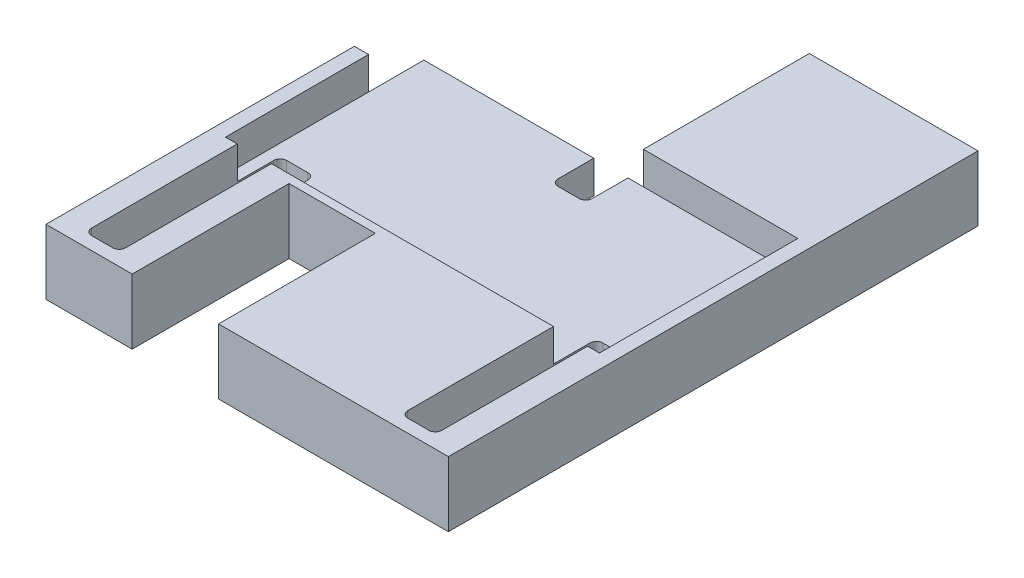
from build123d import *

# Parameters (mm, degrees)
BOSS_EXTRUDE5_DEPTH = 10
CUT_EXTRUDE6_DEPTH  = 5
FILLET4_R           = 1
MIRROR25_DEPTH      = 10
MIRROR25_2_DEPTH    = 5
SKETCH20_W          = 13.27
SKETCH20_H          = 33.288518674
CUT_EXTRUDE7_DEPTH  = 10


# Read off the part's stored shape, not the designer's step: Mirror25
with BuildPart() as part:
    # Sketch15 → Boss-Extrude5 (new body)
    with BuildSketch(Plane(origin=(0, 0, 0), x_dir=(1, 0, 0), z_dir=(0, 1, 0))):
        Polygon((24.3, 76.900659127), (-6.625, 76.900659127), (-6.625, -4.5), (24.3, -4.5), (24.3, 44.900659127), (21.675, 44.900659127), (21.675, 47.400659127), (21.675, 72.400659127), (21.675, 74.900659127), (24.3, 74.900659127), align=None)
        Polygon((-2.625, 25), (-2.625, 0), (-2.625, -2.5), (0, -2.5), (2.625, -2.5), (2.625, 0), (2.625, 25), (2.625, 27.5), (0, 27.5), (-2.625, 27.5), align=None, mode=Mode.SUBTRACT)
    extrude(amount=BOSS_EXTRUDE5_DEPTH)

    # Sketch18 → Cut-Extrude6 (cut)
    with BuildSketch(Plane(origin=(0, 10, 0), x_dir=(1, 0, 0), z_dir=(0, 1, 0))):
        Polygon((21.675, 51.3980649), (-4.44053483, 51.3980649), (-4.44053483, 20.8980649), (24.3, 20.8980649), (24.3, 51.3980649), align=None)
    extrude(amount=-CUT_EXTRUDE6_DEPTH, mode=Mode.SUBTRACT)

    # Fillet4
    fillet4_edges = [part.edges().sort_by_distance(p)[0] for p in [
        (21.675, 5, -74.900659127),
        (-2.625, 5, 2.5),
        (2.625, 5, 2.5),
        (2.625, 2.5, -27.5),
        (-2.625, 2.5, -27.5),
        (21.675, 2.5, -44.900659127),
    ]]
    fillet(fillet4_edges, radius=FILLET4_R)

    # Mirror25 outline → Mirror25 (add)
    with BuildSketch(Plane(origin=(0, 0, 0), x_dir=(1, 0, 0), z_dir=(0, 1, 0))):
        with BuildLine():
            Line((45.975, 20.8980649), (24.3, 20.8980649))
            Line((24.3, 20.8980649), (24.3, -4.5))
            Line((24.3, -4.5), (55.225, -4.5))
            Line((55.225, -4.5), (55.225, 76.900659127))
            Line((55.225, 76.900659127), (24.3, 76.900659127))
            Line((24.3, 76.900659127), (24.3, 74.900659127))
            Line((24.3, 74.900659127), (25.925, 74.900659127))
            ThreePointArc((25.925, 74.900659127), (26.632106781, 74.607765908), (26.925, 73.900659127))
            Line((26.925, 73.900659127), (26.925, 51.3980649))
            Line((26.925, 51.3980649), (53.04053483, 51.3980649))
            Line((53.04053483, 51.3980649), (53.04053483, 20.8980649))
            Line((53.04053483, 20.8980649), (51.225, 20.8980649))
            Line((51.225, 20.8980649), (51.225, -1.5))
            ThreePointArc((51.225, -1.5), (50.932106781, -2.207106781), (50.225, -2.5))
            Line((50.225, -2.5), (46.975, -2.5))
            ThreePointArc((46.975, -2.5), (46.267893219, -2.207106781), (45.975, -1.5))
            Line((45.975, -1.5), (45.975, 20.8980649))
        make_face()
    extrude(amount=MIRROR25_DEPTH)

    # Mirror25 2 outline → Mirror25 2 (add)
    with BuildSketch(Plane(origin=(0, 0, 0), x_dir=(1, 0, 0), z_dir=(0, 1, 0))):
        with BuildLine():
            Line((25.925, 44.900659127), (24.3, 44.900659127))
            Line((24.3, 44.900659127), (24.3, 20.8980649))
            Line((24.3, 20.8980649), (45.975, 20.8980649))
            Line((45.975, 20.8980649), (45.975, 26.5))
            ThreePointArc((45.975, 26.5), (46.267893219, 27.207106781), (46.975, 27.5))
            Line((46.975, 27.5), (50.225, 27.5))
            ThreePointArc((50.225, 27.5), (50.932106781, 27.207106781), (51.225, 26.5))
            Line((51.225, 26.5), (51.225, 20.8980649))
            Line((51.225, 20.8980649), (53.04053483, 20.8980649))
            Line((53.04053483, 20.8980649), (53.04053483, 51.3980649))
            Line((53.04053483, 51.3980649), (26.925, 51.3980649))
            Line((26.925, 51.3980649), (26.925, 45.900659127))
            ThreePointArc((26.925, 45.900659127), (26.632106781, 45.193552346), (25.925, 44.900659127))
        make_face()
    extrude(amount=MIRROR25_2_DEPTH)

    # Sketch20 → Cut-Extrude7 (cut)
    with BuildSketch(Plane(origin=(0, 10, 0), x_dir=(1, 0, 0), z_dir=(0, 1, 0))):
        with Locations((13.258799085, 2.964933045)):
            Rectangle(SKETCH20_W, SKETCH20_H)
        Polygon((-6.625, 76.900659127), (14.49053483, 76.900659127), (14.49053483, 89.151488298), (21.675, 89.151488298), (26.925, 89.151488298), (29.3, 89.151488298), (29.3, 51.3980649), (26.925, 51.3980649), (26.925, 61.088659891), (21.675, 61.088659891), (21.675, 51.3980649), (-4.44053483, 51.3980649), (-4.44053483, 42.900659127), (-6.625, 42.900659127), (-6.625, 56.002594228), align=None)
    extrude(amount=-CUT_EXTRUDE7_DEPTH, mode=Mode.SUBTRACT)


solid = part.part
